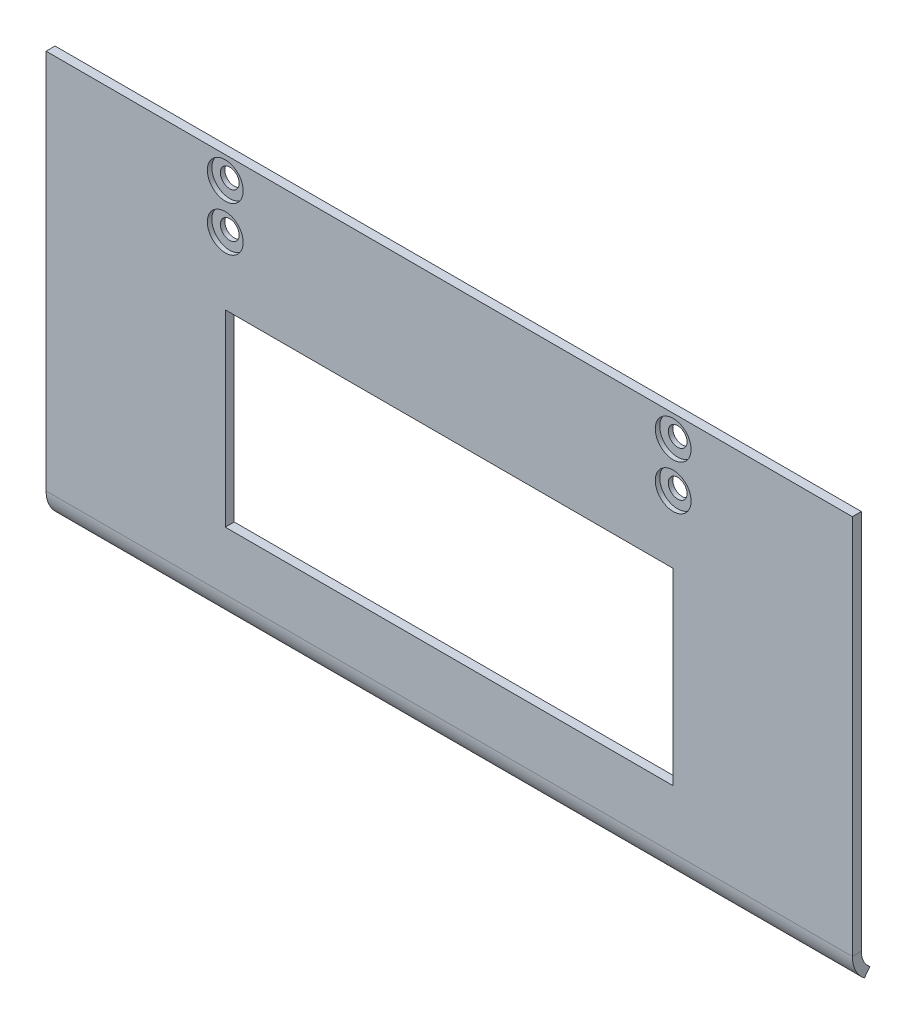
from build123d import *

# Parameters (mm, degrees)
SKETCH_2_W               = 180
SKETCH_2_H               = 90
SM_BASE_FLANGE_1_DEPTH   = 2
SM_START                 = -90
SM_EDGE_FLANGE_1_DEPTH   = 180
SM_EDGE_FLANGE_1_2_DEPTH = 180
SKETCH_10_W              = 100
SKETCH_10_H              = 42.023300627
CUT_EXTRUDE_1_DEPTH      = 10
SKETCH_11_R              = 2.1
CUT_EXTRUDE_2_DEPTH      = 2
SKETCH_12_W              = 25
SKETCH_12_H              = 26.58587188
CUT_EXTRUDE_3_DEPTH      = 10
SKETCH_13_R              = 2.1
SKETCH_13_R_2            = 2.090991101
CUT_EXTRUDE_4_DEPTH      = 10
SKETCH_14_R              = 4
CUT_EXTRUDE_5_DEPTH      = 1


# Read off the part's stored shape, not the designer's step: 边线-法兰1
# Sheet-metal steps are written as plain solids
with BuildPart() as part:
    # Sketch 2 → 基体-法兰1 (new body)
    with BuildSketch(Plane.XY):
        Rectangle(SKETCH_2_W, SKETCH_2_H)
    extrude(amount=-SM_BASE_FLANGE_1_DEPTH)

    # 边线-法兰1 outline → 边线-法兰1 (cut)
    with BuildSketch(Plane.YZ.offset(SM_START)):
        with BuildLine():
            Line((-45, -2), (-44.922280112, -2))
            ThreePointArc((-44.922280112, -2), (-42.669051938, -0.519259301), (-40.023300627, 0))
            Line((-40.023300627, 0), (-45, 0))
            Line((-45, 0), (-45, -2))
        make_face()
    extrude(amount=SM_EDGE_FLANGE_1_DEPTH, mode=Mode.SUBTRACT)

    # Sm Edge Flange 1 2 outline → Sm Edge Flange 1 2 (add)
    with BuildSketch(Plane.YZ.offset(SM_START)):
        with BuildLine():
            ThreePointArc((-44.922280112, -2), (-45.242255885, -2.334969881), (-45.539375902, -2.690369673))
            Line((-45.539375902, -2.690369673), (-61.907273007, -23.640322608))
            Line((-61.907273007, -23.640322608), (-60.3312515, -24.871645559))
            Line((-60.3312515, -24.871645559), (-43.963354395, -3.921692623))
            ThreePointArc((-43.963354395, -3.921692623), (-42.215156361, -2.506029769), (-40.023300627, -2))
            Line((-40.023300627, -2), (-44.922280112, -2))
        make_face()
    extrude(amount=SM_EDGE_FLANGE_1_2_DEPTH)

    # 草图10 → 切除-拉伸1 (cut)
    with BuildSketch(Plane(origin=(0, 0, -2), x_dir=(-1, 0, 0), z_dir=(0, 0, -1))):
        with Locations((0, -6.011650313)):
            Rectangle(SKETCH_10_W, SKETCH_10_H)
    extrude(amount=-CUT_EXTRUDE_1_DEPTH, mode=Mode.SUBTRACT)

    # 草图11 → 切除-拉伸2 (cut)
    with BuildSketch(Plane(origin=(0, -26.972946925, 21.073575737), x_dir=(1, 0, 0), z_dir=(0, -0.788010753606719, 0.6156614753256621))):
        with Locations(Location((60, -43.742751467, 0), (0, 0, 270))):
            Circle(SKETCH_11_R)
        with Locations(Location((20, -43.742751467, 0), (0, 0, 270))):
            Circle(SKETCH_11_R)
        with Locations(Location((-20, -43.742751467, 0), (0, 0, 90))):
            Circle(SKETCH_11_R)
        with Locations(Location((-60, -43.742751467, 0), (0, 0, 90))):
            Circle(SKETCH_11_R)
    extrude(amount=-CUT_EXTRUDE_2_DEPTH, mode=Mode.SUBTRACT)

    # 草图12 → 切除-拉伸3 (cut)
    with BuildSketch(Plane(origin=(0, -25.396925418, 19.842252786), x_dir=(1, 0, 0), z_dir=(0, 0.788010753606719, -0.6156614753256621))):
        with Locations((-77.5, 43.449815527)):
            Rectangle(SKETCH_12_W, SKETCH_12_H)
        with Locations((77.5, 43.449815527)):
            Rectangle(SKETCH_12_W, SKETCH_12_H)
    extrude(amount=-CUT_EXTRUDE_3_DEPTH, mode=Mode.SUBTRACT)

    # 草图13 → 切除-拉伸4 (cut)
    with BuildSketch(Plane(origin=(0, 0, -2), x_dir=(-1, 0, 0), z_dir=(0, 0, -1))):
        with Locations((50, 30)):
            Circle(SKETCH_13_R)
        with Locations((50, 40)):
            Circle(SKETCH_13_R)
        with Locations((-50, 30)):
            Circle(SKETCH_13_R)
        with Locations((-50, 40)):
            Circle(SKETCH_13_R_2)
    extrude(amount=-CUT_EXTRUDE_4_DEPTH, mode=Mode.SUBTRACT)

    # 草图14 → 切除-拉伸5 (cut)
    with BuildSketch(Plane.XY):
        with Locations((-50, 40)):
            Circle(SKETCH_14_R)
        with Locations((-50, 30)):
            Circle(SKETCH_14_R)
        with Locations((50, 40)):
            Circle(SKETCH_14_R)
        with Locations((50, 30)):
            Circle(SKETCH_14_R)
    extrude(amount=-CUT_EXTRUDE_5_DEPTH, mode=Mode.SUBTRACT)


solid = part.part
